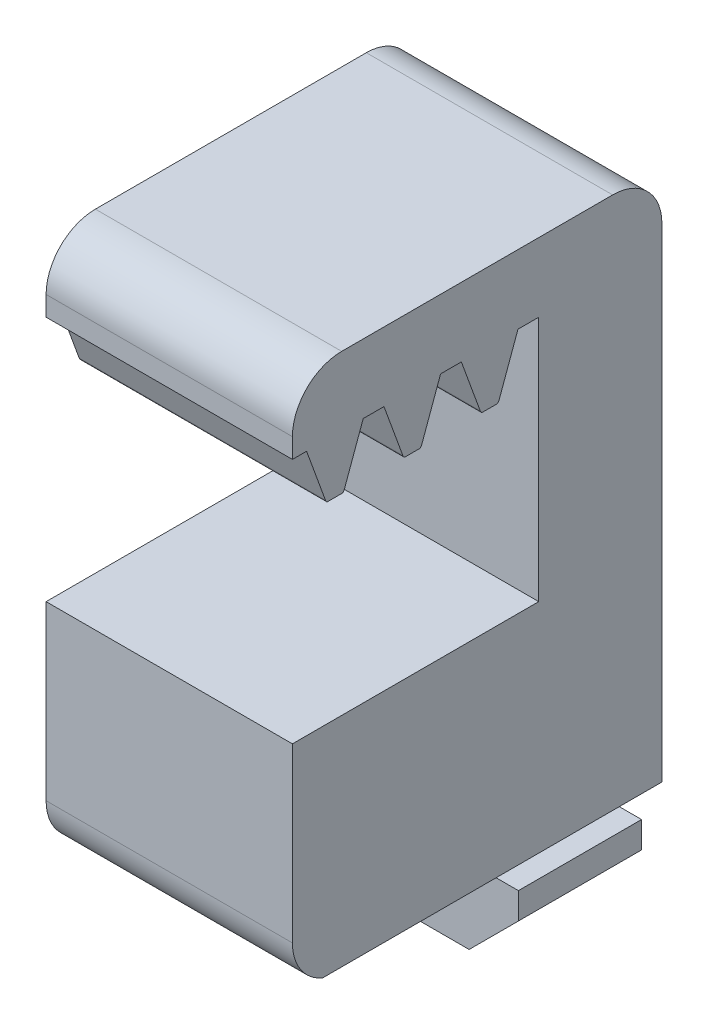
from build123d import *

# Parameters (mm, degrees)
BOSS_EXTRUDE1_DEPTH = 6.35
CUT_EXTRUDE1_DEPTH  = 36.926412234
LPATTERN1_COUNT     = 10
LPATTERN1_PITCH     = 3.989832
CUT_EXTRUDE2_DEPTH  = 35.201456051
FILLET1_R           = 2.54
CUT_EXTRUDE3_DEPTH  = 35.201456051


with BuildPart() as part:
    # Sketch1 → Boss-Extrude1 (new, symmetric)
    with BuildSketch(Plane(origin=(0, 0, 0), x_dir=(0, 0, -1), z_dir=(1, 0, 0))):
        Polygon((12.7, 0), (12.7, -6.096), (19.05, -6.096), (19.05, 27.686), (12.7, 27.686), (0, 27.686), (0, 21.336), (12.7, 21.336), (12.7, 11.43), (0, 11.43), (0, 0), align=None)
    extrude(amount=BOSS_EXTRUDE1_DEPTH, both=True)

    # Sketch2 → Cut-Extrude1 (cut, through all)
    with BuildSketch(Plane(origin=(6.35, 0, 0), x_dir=(0, 0, -1), z_dir=(1, 0, 0))):
        with BuildLine():
            Line((3.649904395, 24.13), (4.720336, 24.13))
            Line((4.720336, 24.13), (5.694793618, 21.452699698))
            ThreePointArc((5.694793618, 21.452699698), (5.787994572, 21.33123785), (5.934007978, 21.2852))
            Line((5.934007978, 21.2852), (6.426064417, 21.2852))
            ThreePointArc((6.426064417, 21.2852), (6.572077823, 21.33123785), (6.665278777, 21.452699698))
            Line((6.665278777, 21.452699698), (7.639736395, 24.13))
            Line((7.639736395, 24.13), (8.710168, 24.13))
            Line((8.710168, 24.13), (9.684625618, 21.452699698))
            ThreePointArc((9.684625618, 21.452699698), (9.777826572, 21.33123785), (9.923839978, 21.2852))
            Line((9.923839978, 21.2852), (10.415896417, 21.2852))
            ThreePointArc((10.415896417, 21.2852), (10.561909823, 21.33123785), (10.655110777, 21.452699698))
            Line((10.655110777, 21.452699698), (11.629568395, 24.13))
            Line((11.629568395, 24.13), (12.7, 24.13))
            Line((12.7, 24.13), (12.7, 11.43))
            Line((12.7, 11.43), (3.649904395, 11.43))
            Line((3.649904395, 11.43), (3.649904395, 24.13))
        make_face()
    cut_extrude1 = extrude(amount=-CUT_EXTRUDE1_DEPTH, mode=Mode.SUBTRACT)

    # LPattern1: Cut-Extrude1 ×10
    with Locations(*[(0, 0, i * LPATTERN1_PITCH) for i in range(1, LPATTERN1_COUNT)]):
        add(cut_extrude1, mode=Mode.SUBTRACT)

    # Sketch3 → Cut-Extrude2 (cut, through all)
    with BuildSketch(Plane(origin=(0, 0, -19.05), x_dir=(-1, 0, 0), z_dir=(0, 0, -1))):
        Polygon((-6.35, -6.096), (-2.839339828, -6.1), (-5.5, -3.439339828), (-5.5, -1.8), (-3.125, -1.8), (-3.125, -1.455), (-4.58, 0), (-9.5, 0), align=None)
        Polygon((2.839339828, -6.1), (6.35, -6.096), (15.42, 0), (4.58, 0), (3.125, -1.455), (3.125, -1.8), (5.5, -1.8), (5.5, -3.439339828), align=None)
    extrude(amount=-CUT_EXTRUDE2_DEPTH, mode=Mode.SUBTRACT)

    # Fillet1
    fillet1_edges = [part.edges().sort_by_distance(p)[0] for p in [
        (0, 0, 0),
        (0, 27.686, 0),
        (0, 27.686, -19.05),
    ]]
    fillet(fillet1_edges, radius=FILLET1_R)

    # Sketch5 → Cut-Extrude3 (cut, through all)
    with BuildSketch(Plane(origin=(0, 0, -19.05), x_dir=(-1, 0, 0), z_dir=(0, 0, -1))):
        Polygon((6.35, 0), (4.58, 0), (3.125, -1.455), (3.125, -1.8), (5.5, -1.8), (5.5, -3.439339828), (2.843339828, -6.096), (-2.843339828, -6.096), (-5.5, -3.439339828), (-5.5, -1.8), (-3.125, -1.8), (-3.125, -1.455), (-4.58, 0), (-6.35, 0), (-6.35, 0.1984375), (-4.497804496, 0.1984375), (-2.9265625, -1.372804496), (-2.9265625, -1.9984375), (-5.3015625, -1.9984375), (-5.3015625, -3.357144324), (-2.761144324, -5.8975625), (2.761144324, -5.8975625), (5.3015625, -3.357144324), (5.3015625, -1.9984375), (2.9265625, -1.9984375), (2.9265625, -1.372804496), (4.497804496, 0.1984375), (6.35, 0.1984375), align=None)
    extrude(amount=-CUT_EXTRUDE3_DEPTH, mode=Mode.SUBTRACT)


solid = part.part
